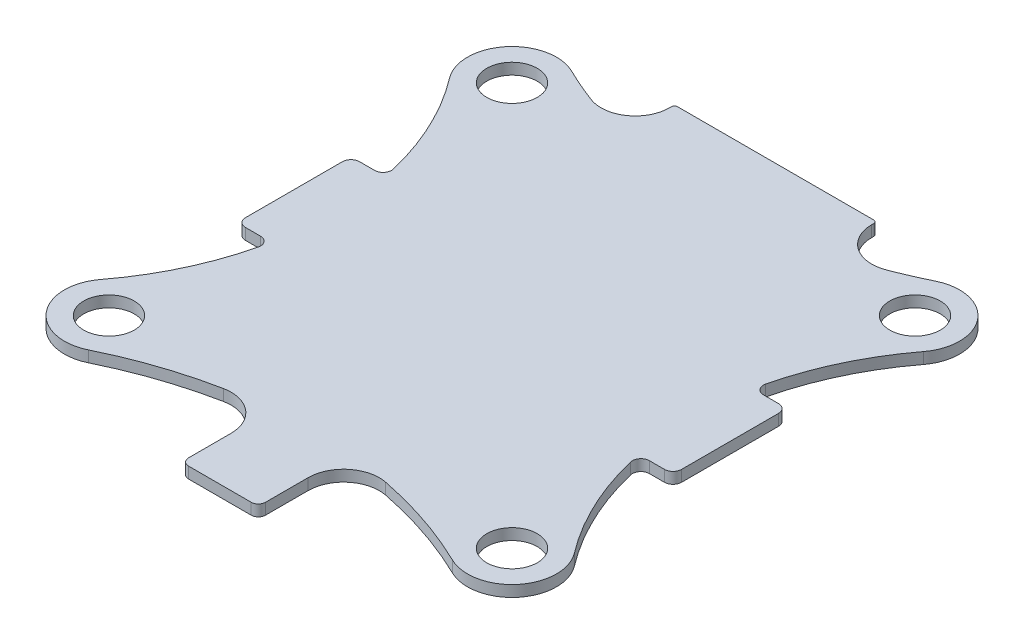
from build123d import *

# Parameters (mm, degrees)
SKETCH1_R           = 2.25
BOSS_EXTRUDE2_DEPTH = 1


with BuildPart() as part:
    # Sketch1 → Boss-Extrude2 (new body)
    with BuildSketch(Plane(origin=(0, 0, 0), x_dir=(1, 0, 0), z_dir=(0, 1, 0))):
        with BuildLine():
            Line((-18.669, -5.08), (-17.330956316, -5.08))
            ThreePointArc((-17.330956316, -5.08), (-16.732344988, -5.370503999), (-16.590161442, -6.020513179))
            ThreePointArc((-16.590161442, -6.020513179), (-18.359695736, -11.0243031), (-21.119367367, -15.557886415))
            ThreePointArc((-21.119367367, -15.557886415), (-21.028176895, -20.478529347), (-16.219689319, -21.527094936))
            ThreePointArc((-16.219689319, -21.527094936), (-11.819779224, -19.719953138), (-7.224293819, -18.492563955))
            ThreePointArc((-7.224293819, -18.492563955), (-4.590148947, -19.151788204), (-3.429, -21.60638164))
            Line((-3.429, -21.60638164), (-3.429, -25.4))
            ThreePointArc((-3.429, -25.4), (-3.243012806, -25.849012806), (-2.794, -26.035))
            Line((-2.794, -26.035), (2.794, -26.035))
            ThreePointArc((2.794, -26.035), (3.243012806, -25.849012806), (3.429, -25.4))
            Line((3.429, -25.4), (3.429, -21.60638164))
            ThreePointArc((3.429, -21.60638164), (4.590148947, -19.151788204), (7.224293819, -18.492563955))
            ThreePointArc((7.224293819, -18.492563955), (11.819779224, -19.719953138), (16.219689319, -21.527094936))
            ThreePointArc((16.219689319, -21.527094936), (21.028176895, -20.478529347), (21.119367367, -15.557886415))
            ThreePointArc((21.119367367, -15.557886415), (18.359695736, -11.0243031), (16.590161442, -6.020513179))
            ThreePointArc((16.590161442, -6.020513179), (16.732344988, -5.370503999), (17.330956316, -5.08))
            Line((17.330956316, -5.08), (18.669, -5.08))
            ThreePointArc((18.669, -5.08), (19.207815367, -4.856815367), (19.431, -4.318))
            Line((19.431, -4.318), (19.431, 4.318))
            ThreePointArc((19.431, 4.318), (19.207815367, 4.856815367), (18.669, 5.08))
            Line((18.669, 5.08), (17.330956316, 5.08))
            ThreePointArc((17.330956316, 5.08), (16.732344988, 5.370503999), (16.590161442, 6.020513179))
            ThreePointArc((16.590161442, 6.020513179), (18.359695736, 11.0243031), (21.119367367, 15.557886415))
            ThreePointArc((21.119367367, 15.557886415), (21.028176895, 20.478529347), (16.219689319, 21.527094936))
            ThreePointArc((16.219689319, 21.527094936), (14.699316522, 20.827163372), (13.148827901, 20.196748688))
            ThreePointArc((13.148827901, 20.196748688), (10.334855995, 20.536177996), (9.017, 23.045541604))
            Line((9.017, 23.045541604), (9.017, 23.241))
            ThreePointArc((9.017, 23.241), (8.942605122, 23.420605122), (8.763, 23.495))
            Line((8.763, 23.495), (-8.763, 23.495))
            ThreePointArc((-8.763, 23.495), (-8.942605122, 23.420605122), (-9.017, 23.241))
            Line((-9.017, 23.241), (-9.017, 23.045541604))
            ThreePointArc((-9.017, 23.045541604), (-10.334855995, 20.536177996), (-13.148827901, 20.196748688))
            ThreePointArc((-13.148827901, 20.196748688), (-14.699316522, 20.827163372), (-16.219689319, 21.527094936))
            ThreePointArc((-16.219689319, 21.527094936), (-21.028176895, 20.478529347), (-21.119367367, 15.557886415))
            ThreePointArc((-21.119367367, 15.557886415), (-18.359695736, 11.0243031), (-16.590161442, 6.020513179))
            ThreePointArc((-16.590161442, 6.020513179), (-16.732344988, 5.370503999), (-17.330956316, 5.08))
            Line((-17.330956316, 5.08), (-18.669, 5.08))
            ThreePointArc((-18.669, 5.08), (-19.207815367, 4.856815367), (-19.431, 4.318))
            Line((-19.431, 4.318), (-19.431, -4.318))
            ThreePointArc((-19.431, -4.318), (-19.207815367, -4.856815367), (-18.669, -5.08))
        make_face()
        with Locations((-17.960512242, -17.960512242)):
            Circle(SKETCH1_R, mode=Mode.SUBTRACT)
        with Locations((17.960512242, -17.960512242)):
            Circle(SKETCH1_R, mode=Mode.SUBTRACT)
        with Locations((-17.960512242, 17.960512242)):
            Circle(SKETCH1_R, mode=Mode.SUBTRACT)
        with Locations((17.960512242, 17.960512242)):
            Circle(SKETCH1_R, mode=Mode.SUBTRACT)
    extrude(amount=BOSS_EXTRUDE2_DEPTH)


solid = part.part
